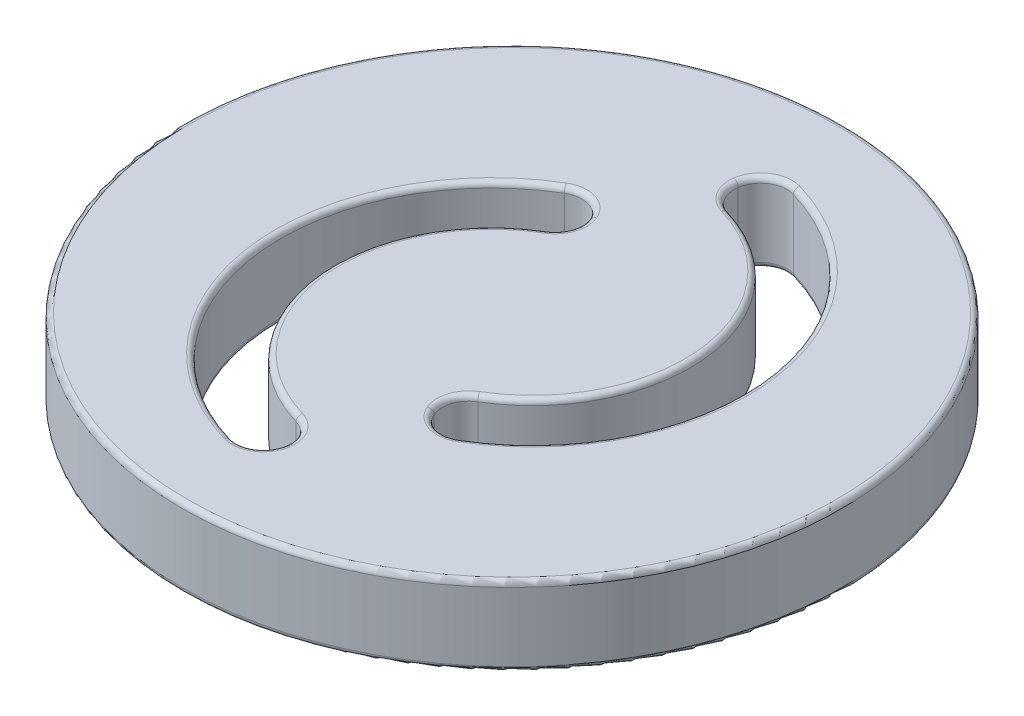
from build123d import *

# Parameters (mm, degrees)
SKETCH_1_R          = 125
SKETCH_1_R_2        = 20
EXTRUDE_1_DEPTH     = 30
CUT_EXTRUDE_1_DEPTH = 30
FILLET_3_R          = 10
SKETCH_1_3_R        = 20
EXTRUDE_2_DEPTH     = 30
FILLET_4_R          = 2
SKETCH_1_4_R        = 20
EXTRUDE_3_DEPTH     = 15
FILLET_5_R          = 2


with BuildPart() as part:
    # 草图1 → 凸台-拉伸1 (new body)
    with BuildSketch(Plane(origin=(0, 0, 0), x_dir=(1, 0, 0), z_dir=(0, 1, 0))):
        with Locations(Location((0, 0, 0), (0, 0, 270))):
            Circle(SKETCH_1_R)
        with Locations(Location((0, 0, 0), (0, 0, 270))):
            Circle(SKETCH_1_R_2, mode=Mode.SUBTRACT)
    extrude(amount=EXTRUDE_1_DEPTH)

    # 草图2 → 切除-拉伸1 (cut)
    with BuildSketch(Plane(origin=(0, 30, 0), x_dir=(1, 0, 0), z_dir=(0, 1, 0))):
        with BuildLine():
            Line((1.395674395, 96.50212568), (-1.395674395, 76.69787432))
            ThreePointArc((-1.395674395, 76.69787432), (49.589198145, 25.061305382), (13.255952188, -37.753404024))
            Line((13.255952188, -37.753404024), (20.946062145, -56.215858055))
            ThreePointArc((20.946062145, -56.215858055), (69.427303642, 27.600905796), (1.395674395, 96.50212568))
        make_face()
        with BuildLine():
            Line((-13.255952188, 37.753404024), (-20.946062145, 56.215858055))
            ThreePointArc((-20.946062145, 56.215858055), (-69.427303642, -27.600905796), (-1.395674395, -96.50212568))
            Line((-1.395674395, -96.50212568), (1.395674395, -76.69787432))
            ThreePointArc((1.395674395, -76.69787432), (-49.589198145, -25.061305382), (-13.255952188, 37.753404024))
        make_face()
    extrude(amount=-CUT_EXTRUDE_1_DEPTH, mode=Mode.SUBTRACT)

    # 圆角3
    fillet_3_edges = [part.edges().sort_by_distance(p)[0] for p in [
        (-20.946062145, 15, -56.215858055),
        (-13.255952188, 15, -37.753404024),
        (-1.395674395, 15, 96.50212568),
        (1.395674395, 15, 76.69787432),
        (20.946062145, 15, 56.215858055),
        (13.255952188, 15, 37.753404024),
        (-1.395674395, 15, -76.69787432),
        (1.395674395, 15, -96.50212568),
    ]]
    fillet(fillet_3_edges, radius=FILLET_3_R - 0.0001)  # a hair under: the kernel refuses the full size

    # 草图1<3> → 凸台-拉伸2 (add)
    with BuildSketch(Plane(origin=(0, 0, 0), x_dir=(1, 0, 0), z_dir=(0, 1, 0))):
        Circle(SKETCH_1_3_R)
    extrude(amount=EXTRUDE_2_DEPTH)

    # 圆角4
    fillet_4_edges = [part.edges().sort_by_distance(p)[0] for p in [
        (0, 0, -125),
        (-69.427303642, 30, 27.600905796),
        (-69.427303642, 0, 27.600905796),
        (-49.589198145, 30, 25.061305382),
        (-49.589198145, 0, 25.061305382),
        (69.427303642, 30, -27.600905796),
        (69.427303642, 0, -27.600905796),
        (49.589198145, 30, -25.061305382),
        (49.589198145, 0, -25.061305382),
        (0, 30, -125),
        (-22.920540142, 30, -51.971024611),
        (-22.920540142, 0, -51.971024611),
        (-16.559492515, 30, -39.340160323),
        (-16.559492515, 0, -39.340160323),
        (-4.375771536, 30, 92.891558501),
        (-4.375771536, 0, 92.891558501),
        (-1.401623113, 30, 79.065637167),
        (-1.401623113, 0, 79.065637167),
        (22.920540142, 30, 51.971024611),
        (22.920540142, 0, 51.971024611),
        (16.559492515, 30, 39.340160323),
        (16.559492515, 0, 39.340160323),
        (1.401623113, 30, -79.065637167),
        (1.401623113, 0, -79.065637167),
        (4.375771536, 30, -92.891558501),
        (4.375771536, 0, -92.891558501),
    ]]
    fillet(fillet_4_edges, radius=FILLET_4_R)

    # 草图1<4> → 凸台-拉伸3 (add)
    with BuildSketch(Plane(origin=(0, 0, 0), x_dir=(1, 0, 0), z_dir=(0, 1, 0))):
        with Locations(Location((0, 0, 0), (0, 0, 270))):
            Circle(SKETCH_1_4_R)
    extrude(amount=-EXTRUDE_3_DEPTH)

    # 圆角5
    fillet_5_edges = [part.edges().sort_by_distance(p)[0] for p in [
        (0, -15, -20),
        (0, 0, -20),
    ]]
    fillet(fillet_5_edges, radius=FILLET_5_R)


solid = part.part
